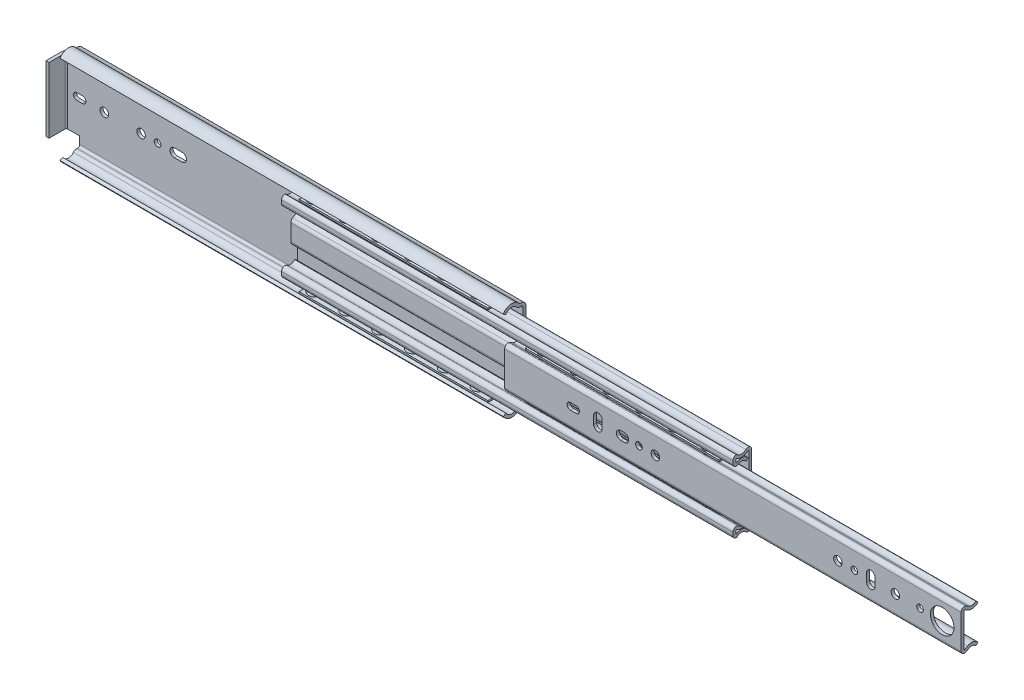
from build123d import *
from build123d.topology import SkipClean

# Parameters (mm, degrees)
EXTRUDE_THIN1_START     = -177.8
EXTRUDE_THIN1_DEPTH     = 355.6
EXTRUDE_THIN2_DEPTH     = 349.25
EXTRUDE_THIN5_START     = -353.06
EXTRUDE_THIN5_DEPTH     = 353.06
CUT_EXTRUDE1_DEPTH      = 535.874689297
CUT_EXTRUDE1_DEPTH_BACK = 535.874689297
SKETCH6_W               = 12.7
SKETCH6_H               = 12.7
SKETCH9_W               = 2.3622
SKETCH9_H               = 13.3858
EXTRUDE1_DEPTH          = 25.4
FILLET1_R               = 1.016
FILLET2_R               = 3.3782
CUT_EXTRUDE2_DEPTH      = 2.3622
SKETCH28_R              = 3.302
CUT_F_DEPTH             = 2.3622
SKETCH29_R              = 2.5781
CUT_EXTRUDE18_DEPTH     = 2.3622
CUT_H_DEPTH             = 2.3622
CUT_J_DEPTH             = 2.3622
SKETCH32_R              = 2.5781
SKETCH32_R_2            = 3.302
CUT_EXTRUDE21_DEPTH     = 2.3622
SKETCH214_R             = 2.5781
SKETCH214_R_2           = 3.302
CUT_EXTRUDE113_DEPTH    = 2.3622
SKETCH215_R             = 3.302
CUT_EXTRUDE114_DEPTH    = 2.3622
CUT_R_DEPTH             = 2.3622
LPATTERN1_COUNT         = 6
LPATTERN1_PITCH         = 25.4
EXTRUDE2_DEPTH          = 12.7
EXTRUDE2_DEPTH_BACK     = 133.35
SKETCH218_W             = 11.43
SKETCH218_H             = 1.27
LPATTERN2_COUNT         = 6
LPATTERN2_PITCH         = 25.4
EXTRUDE3_DEPTH          = 12.7
EXTRUDE3_DEPTH_BACK     = 137.16
SKETCH220_W             = 9.245599771
SKETCH220_H             = 1.27


# Read off the part's stored shape, not the designer's step: Extrude-Thin1, Extrude-Thin5
with BuildPart() as part:
    # Extrude-Thin1 outline → Extrude-Thin1 (new body)
    with BuildSketch(Plane(origin=(0, 0, 0), x_dir=(0, 0, -1), z_dir=(1, 0, 0)).offset(EXTRUDE_THIN1_START)):
        with BuildLine():
            ThreePointArc((5.752462483, 35.334775085), (-0.647910774, 38.071449668), (-6.469678085, 34.255536805))
            Line((-6.469678085, 34.255536805), (-4.394919251, 33.126216382))
            ThreePointArc((-4.394919251, 33.126216382), (-0.440132491, 35.718405464), (3.907707273, 33.85935411))
            ThreePointArc((3.907707273, 33.85935411), (4.993998236, 32.994951487), (6.347544809, 32.686517335))
            Line((6.347544809, 32.686517335), (7.175193262, 32.686517335))
            ThreePointArc((7.175193262, 32.686517335), (8.297725277, 32.22154935), (8.762693262, 31.099017335))
            Line((8.762693262, 31.099017335), (8.762693262, 0))
            Line((8.762693262, 0), (11.124893262, 0))
            Line((11.124893262, 0), (11.124893262, 31.099017335))
            ThreePointArc((11.124893262, 31.099017335), (9.968052916, 33.891876989), (7.175193262, 35.048717335))
            Line((7.175193262, 35.048717335), (6.347544809, 35.048717335))
            ThreePointArc((6.347544809, 35.048717335), (6.017411498, 35.123945177), (5.752462483, 35.334775085))
        make_face()
    extrude(amount=EXTRUDE_THIN1_DEPTH)

    # Sketch6 → Cut-Extrude1 (cut, two sides: drawn at the far end of the back side and taken through both)
    with BuildSketch(Plane.XY.offset(-CUT_EXTRUDE1_DEPTH_BACK)):
        with Locations((-171.45, 31.75)):
            Rectangle(SKETCH6_W, SKETCH6_H)
    extrude(amount=CUT_EXTRUDE1_DEPTH + CUT_EXTRUDE1_DEPTH_BACK, mode=Mode.SUBTRACT)

    # Sketch9 → Extrude1 (add)
    with BuildSketch(Plane(origin=(0, 25.4, 0), x_dir=(-1, 0, 0), z_dir=(0, 1, 0))):
        with Locations((176.6189, -2.069793262)):
            Rectangle(SKETCH9_W, SKETCH9_H)
    extrude(amount=-EXTRUDE1_DEPTH)

    # Fillet1
    fillet1_edges = [part.edges().sort_by_distance(p)[0] for p in [
        (-175.4378, 12.7, -8.762693262),
    ]]
    fillet(fillet1_edges, radius=FILLET1_R)

    # Fillet2
    fillet2_edges = [part.edges().sort_by_distance(p)[0] for p in [
        (-177.8, 12.7, -11.124893262),
    ]]
    fillet(fillet2_edges, radius=FILLET2_R)

    # Sketch32 → Cut-Extrude21 (cut)
    with BuildSketch(Plane.XY.offset(-8.762693262)):
        with Locations((165.1, 0)):
            Circle(SKETCH32_R)
        with Locations((146.05, 0)):
            Circle(SKETCH32_R_2)
        with Locations((88.9, 0)):
            Circle(SKETCH32_R_2)
        with Locations((101.6, 0)):
            Circle(SKETCH32_R)
        with BuildLine():
            Line((117.348, 0), (130.048, 0))
            ThreePointArc((130.048, 0), (129.080866591, 2.334866591), (126.746, 3.302))
            Line((126.746, 3.302), (120.65, 3.302))
            ThreePointArc((120.65, 3.302), (118.315133409, 2.334866591), (117.348, 0))
        make_face()
    extrude(amount=-CUT_EXTRUDE21_DEPTH, mode=Mode.SUBTRACT)

    # Sketch214 → Cut-Extrude113 (cut)
    with BuildSketch(Plane(origin=(529.798432462, 18.139402612, -8.762693262), x_dir=(1, 0, 0), z_dir=(0, 0, 1))):
        with Locations((-634.700432462, -18.139402612)):
            Circle(SKETCH214_R)
        with Locations((-647.400432462, -18.139402612)):
            Circle(SKETCH214_R_2)
        with BuildLine():
            Line((-612.348432462, -18.139402612), (-625.048432462, -18.139402612))
            ThreePointArc((-625.048432462, -18.139402612), (-624.081299054, -15.80453602), (-621.746432462, -14.837402612))
            Line((-621.746432462, -14.837402612), (-615.650432462, -14.837402612))
            ThreePointArc((-615.650432462, -14.837402612), (-613.315565871, -15.80453602), (-612.348432462, -18.139402612))
        make_face()
    extrude(amount=-CUT_EXTRUDE113_DEPTH, mode=Mode.SUBTRACT)

    # Sketch215 → Cut-Extrude114 (cut)
    with BuildSketch(Plane(origin=(674.3557152, 11.320285871, -8.762693262), x_dir=(1, 0, 0), z_dir=(0, 0, 1))):
        with Locations((-820.4057152, -11.320285871)):
            Circle(SKETCH215_R)
    extrude(amount=-CUT_EXTRUDE114_DEPTH, mode=Mode.SUBTRACT)

    # Sketch216 → Cut R (cut)
    with BuildSketch(Plane.XY.offset(-8.762693262)):
        with BuildLine():
            Line((-169.8625, 0), (-160.3375, 0))
            ThreePointArc((-160.3375, 0), (-161.092608007, 1.822991993), (-162.9156, 2.5781))
            Line((-162.9156, 2.5781), (-167.2844, 2.5781))
            ThreePointArc((-167.2844, 2.5781), (-169.107391993, 1.822991993), (-169.8625, 0))
        make_face()
    extrude(amount=-CUT_R_DEPTH, mode=Mode.SUBTRACT)

    # Mirror1 3: part across plane


with BuildPart() as body_2:
    # Sketch4 → Extrude-Thin2 (new body)
    with BuildSketch(Plane(origin=(355.6, 0, 0), x_dir=(0, 0, -1), z_dir=(1, 0, 0))):
        with BuildLine():
            ThreePointArc((3.54024831, 19.789205828), (0.77024158, 21.457292879), (-2.36668079, 20.672965307))
            ThreePointArc((-2.36668079, 20.672965307), (-3.066628466, 20.302667649), (-3.845303472, 20.158749826))
            ThreePointArc((-3.845303472, 20.158749826), (-5.74716136, 20.89546867), (-6.542172842, 22.773705828))
            Line((-6.542172842, 22.773705828), (-6.542172842, 25.161305828))
            ThreePointArc((-6.542172842, 25.161305828), (-5.766174756, 27.020918518), (-3.898522237, 27.77736181))
            ThreePointArc((-3.898522237, 27.77736181), (-3.659975019, 27.729624759), (-3.455361804, 27.598030559))
            ThreePointArc((-3.455361804, 27.598030559), (-0.023095262, 26.226172038), (3.414460302, 27.584723163))
            ThreePointArc((3.414460302, 27.584723163), (6.244879756, 28.080225918), (7.822893148, 25.678836527))
            Line((7.822893148, 25.678836527), (7.822893148, 11.408756936))
            ThreePointArc((7.822893148, 11.408756936), (7.431553352, 9.948256936), (6.362393148, 8.879096732))
            Line((6.362393148, 8.879096732), (3.123893148, 7.009347885))
            ThreePointArc((3.123893148, 7.009347885), (2.84498179, 6.730436527), (2.742893148, 6.349436527))
            Line((2.742893148, 6.349436527), (2.742893148, 0))
            Line((2.742893148, 0), (0.583893148, 0))
            Line((0.583893148, 0), (0.583893148, 6.349436527))
            ThreePointArc((0.583893148, 6.349436527), (0.975232943, 7.809936527), (2.044393148, 8.879096732))
            Line((2.044393148, 8.879096732), (5.282893148, 10.748845578))
            ThreePointArc((5.282893148, 10.748845578), (5.561804505, 11.027756936), (5.663893148, 11.408756936))
            Line((5.663893148, 11.408756936), (5.663893148, 25.678836527))
            ThreePointArc((5.663893148, 25.678836527), (5.388123817, 26.098496809), (4.893487408, 26.011904095))
            ThreePointArc((4.893487408, 26.011904095), (0.412345154, 24.079826794), (-4.266408016, 25.466487303))
            ThreePointArc((-4.266408016, 25.466487303), (-4.352985021, 25.324684037), (-4.383172842, 25.161305828))
            Line((-4.383172842, 25.161305828), (-4.383172842, 22.773705828))
            ThreePointArc((-4.383172842, 22.773705828), (-4.244238797, 22.445470208), (-3.911875283, 22.316723226))
            ThreePointArc((-3.911875283, 22.316723226), (-3.775796155, 22.341873913), (-3.653475202, 22.406586125))
            ThreePointArc((-3.653475202, 22.406586125), (1.089702598, 23.592527212), (5.278086268, 21.070299201))
            Line((5.278086268, 21.070299201), (3.54024831, 19.789205828))
        make_face()
    extrude(amount=-EXTRUDE_THIN2_DEPTH)

    # Mirror1: body 2 across plane


with BuildPart() as body_3:
    # Extrude-Thin5 outline → Extrude-Thin5 (new body)
    with BuildSketch(Plane(origin=(533.4, 0, 0), x_dir=(0, 0, -1), z_dir=(1, 0, 0)).offset(EXTRUDE_THIN5_START)):
        with BuildLine():
            Line((-7.925106738, 0), (-5.562906738, 0))
            Line((-5.562906738, 0), (-5.562906738, 13.036209579))
            ThreePointArc((-5.562906738, 13.036209579), (-5.437890097, 13.255022954), (-5.185904431, 13.258440163))
            Line((-5.185904431, 13.258440163), (-2.932066495, 12.010964405))
            ThreePointArc((-2.932066495, 12.010964405), (1.369676528, 11.28348431), (5.180595526, 13.407423274))
            Line((5.180595526, 13.407423274), (3.41147618, 14.972736527))
            ThreePointArc((3.41147618, 14.972736527), (0.968956668, 13.611447462), (-1.788145038, 14.077708835))
            Line((-1.788145038, 14.077708835), (-4.041982973, 15.325184593))
            ThreePointArc((-4.041982973, 15.325184593), (-6.637435339, 15.28998734), (-7.925106738, 13.036209579))
            Line((-7.925106738, 13.036209579), (-7.925106738, 0))
        make_face()
    extrude(amount=EXTRUDE_THIN5_DEPTH)

    # Sketch10 → Cut-Extrude2 (cut)
    with BuildSketch(Plane.XY.offset(7.925106738)):
        with BuildLine():
            Line((509.67005, 0), (527.95805, 0))
            ThreePointArc((527.95805, 0), (518.81405, 9.144), (509.67005, 0))
        make_face()
        with BuildLine():
            Line((504.2281, 0), (499.0719, 0))
            ThreePointArc((499.0719, 0), (501.65, 2.5781), (504.2281, 0))
        make_face()
        with BuildLine():
            Line((485.902, 0), (479.298, 0))
            ThreePointArc((479.298, 0), (482.6, 3.302), (485.902, 0))
        make_face()
        with BuildLine():
            Line((466.852, 3.048), (466.852, 0))
            Line((466.852, 0), (460.248, 0))
            Line((460.248, 0), (460.248, 3.048))
            ThreePointArc((460.248, 3.048), (463.55, 6.35), (466.852, 3.048))
        make_face()
        with BuildLine():
            Line((453.4281, 0), (448.2719, 0))
            ThreePointArc((448.2719, 0), (450.85, 2.5781), (453.4281, 0))
        make_face()
        with BuildLine():
            Line((441.452, 0), (434.848, 0))
            ThreePointArc((434.848, 0), (438.15, 3.302), (441.452, 0))
        make_face()
    extrude(amount=-CUT_EXTRUDE2_DEPTH, mode=Mode.SUBTRACT)

    # Sketch28 → Cut F (cut)
    with BuildSketch(Plane.XY.offset(7.925106738)):
        with Locations((296.926, 0)):
            Circle(SKETCH28_R)
    extrude(amount=-CUT_F_DEPTH, mode=Mode.SUBTRACT)

    # Sketch29 → Cut-Extrude18 (cut)
    with BuildSketch(Plane(origin=(-866.129297637, 5.417355799, 7.925106738), x_dir=(1, 0, 0), z_dir=(0, 0, 1))):
        with Locations((1150.355297637, -5.417355799)):
            Circle(SKETCH29_R)
        with BuildLine():
            Line((1142.417797637, -5.417355799), (1132.892797637, -5.417355799))
            ThreePointArc((1132.892797637, -5.417355799), (1133.859931046, -3.082489207), (1136.194797637, -2.115355799))
            Line((1136.194797637, -2.115355799), (1139.115797637, -2.115355799))
            ThreePointArc((1139.115797637, -2.115355799), (1141.450664228, -3.082489207), (1142.417797637, -5.417355799))
        make_face()
    extrude(amount=-CUT_EXTRUDE18_DEPTH, mode=Mode.SUBTRACT)

    # Sketch30 → Cut H (cut)
    with BuildSketch(Plane.XY.offset(7.925106738)):
        with BuildLine():
            Line((249.174, 0), (249.174, 3.048))
            ThreePointArc((249.174, 3.048), (252.476, 6.35), (255.778, 3.048))
            Line((255.778, 3.048), (255.778, 0))
            Line((255.778, 0), (249.174, 0))
        make_face()
    extrude(amount=-CUT_H_DEPTH, mode=Mode.SUBTRACT)

    # Sketch31 → Cut J (cut)
    with BuildSketch(Plane.XY.offset(7.925106738)):
        with BuildLine():
            Line((238.1885, 0), (228.6635, 0))
            ThreePointArc((228.6635, 0), (229.418608007, 1.822991993), (231.2416, 2.5781))
            Line((231.2416, 2.5781), (235.6104, 2.5781))
            ThreePointArc((235.6104, 2.5781), (237.433391993, 1.822991993), (238.1885, 0))
        make_face()
    extrude(amount=-CUT_J_DEPTH, mode=Mode.SUBTRACT)

    # Mirror1 2: body 3 across plane


with BuildPart() as body_2_1:
    add(body_2.part)
    add(body_2.part.mirror(Plane.ZX))


with BuildPart() as body_3_1:
    with SkipClean():  # the faces are left unmerged after this step: merging them gives an invalid solid
        add(body_3.part)
        add(body_3.part.mirror(Plane.ZX))


with BuildPart() as part_1:
    with SkipClean():  # the faces are left unmerged after this step: merging them gives an invalid solid
        add(part.part)
        add(part.part.mirror(Plane.ZX))


with BuildPart() as body_4:
    # Sketch217 → Revolve1 (revolve)
    with BuildSketch(Plane(origin=(152.4, 0, 0), x_dir=(0, 0, -1), z_dir=(1, 0, 0))):
        with BuildLine():
            Line((0, 35.7378), (0, 26.22652483))
            ThreePointArc((0, 26.22652483), (4.755637585, 30.982162415), (0, 35.7378))
        make_face()
    revolve(axis=Axis((152.4, 36.603094088, 0), (0, -1, 0)))


with BuildPart() as lpattern1_1:
    # LPattern1: pattern copy
    add(body_4.part.moved(Location(Vector(-1, 0, 0) * (1 * LPATTERN1_PITCH))))


with BuildPart() as lpattern1_2:
    # LPattern1: pattern copy
    add(body_4.part.moved(Location(Vector(-1, 0, 0) * (2 * LPATTERN1_PITCH))))


with BuildPart() as lpattern1_3:
    # LPattern1: pattern copy
    add(body_4.part.moved(Location(Vector(-1, 0, 0) * (3 * LPATTERN1_PITCH))))


with BuildPart() as lpattern1_4:
    # LPattern1: pattern copy
    add(body_4.part.moved(Location(Vector(-1, 0, 0) * (4 * LPATTERN1_PITCH))))


with BuildPart() as lpattern1_5:
    # LPattern1: pattern copy
    add(body_4.part.moved(Location(Vector(-1, 0, 0) * (5 * LPATTERN1_PITCH))))


with BuildPart() as body_4_1:
    add(body_4.part)

    add(lpattern1_1.part)  # Extrude2 merges LPattern1_1

    add(lpattern1_2.part)  # Extrude2 merges LPattern1_2

    add(lpattern1_3.part)  # Extrude2 merges LPattern1_3

    add(lpattern1_4.part)  # Extrude2 merges LPattern1_4

    add(lpattern1_5.part)  # Extrude2 merges LPattern1_5
    # Sketch218 → Extrude2 (add, two sides: drawn at the far end of the back side and taken through both)
    with BuildSketch(Plane(origin=(152.4, 0, 0), x_dir=(0, 0, -1), z_dir=(1, 0, 0)).offset(-EXTRUDE2_DEPTH_BACK)):
        with Locations((0, 30.9753)):
            Rectangle(SKETCH218_W, SKETCH218_H)
    extrude(amount=EXTRUDE2_DEPTH + EXTRUDE2_DEPTH_BACK)


with BuildPart() as body_5:
    # Sketch219 → Revolve2 (revolve)
    with BuildSketch(Plane(origin=(330.2, 0, 0), x_dir=(0, 0, -1), z_dir=(1, 0, 0))):
        with BuildLine():
            Line((-0.000306852, 21.487836527), (-0.000306852, 13.550336527))
            ThreePointArc((-0.000306852, 13.550336527), (3.968443148, 17.519086527), (-0.000306852, 21.487836527))
        make_face()
    revolve(axis=Axis((330.2, 22.284965157, 0.000306852), (0, -1, 0)))


with BuildPart() as lpattern2_1:
    # LPattern2: pattern copy
    add(body_5.part.moved(Location(Vector(-1, 0, 0) * (1 * LPATTERN2_PITCH))))


with BuildPart() as lpattern2_2:
    # LPattern2: pattern copy
    add(body_5.part.moved(Location(Vector(-1, 0, 0) * (2 * LPATTERN2_PITCH))))


with BuildPart() as lpattern2_3:
    # LPattern2: pattern copy
    add(body_5.part.moved(Location(Vector(-1, 0, 0) * (3 * LPATTERN2_PITCH))))


with BuildPart() as lpattern2_4:
    # LPattern2: pattern copy
    add(body_5.part.moved(Location(Vector(-1, 0, 0) * (4 * LPATTERN2_PITCH))))


with BuildPart() as lpattern2_5:
    # LPattern2: pattern copy
    add(body_5.part.moved(Location(Vector(-1, 0, 0) * (5 * LPATTERN2_PITCH))))


with BuildPart() as body_5_1:
    add(body_5.part)

    add(lpattern2_1.part)  # Extrude3 merges LPattern2_1

    add(lpattern2_2.part)  # Extrude3 merges LPattern2_2

    add(lpattern2_3.part)  # Extrude3 merges LPattern2_3

    add(lpattern2_4.part)  # Extrude3 merges LPattern2_4

    add(lpattern2_5.part)  # Extrude3 merges LPattern2_5
    # Sketch220 → Extrude3 (add, two sides: drawn at the far end of the back side and taken through both)
    with BuildSketch(Plane(origin=(330.2, 0, 0), x_dir=(0, 0, -1), z_dir=(1, 0, 0)).offset(-EXTRUDE3_DEPTH_BACK)):
        with Locations((-0.000306853, 17.519086527)):
            Rectangle(SKETCH220_W, SKETCH220_H)
    extrude(amount=EXTRUDE3_DEPTH + EXTRUDE3_DEPTH_BACK)


with BuildPart() as body_6:
    # Mirror3: mirrored copy
    add(body_4_1.part.mirror(Plane.ZX))


with BuildPart() as body_7:
    # Mirror3 2: mirrored copy
    add(body_5_1.part.mirror(Plane.ZX))


solid = Compound([body_2_1.part, body_3_1.part, part_1.part, body_4_1.part, body_5_1.part, body_6.part, body_7.part])
